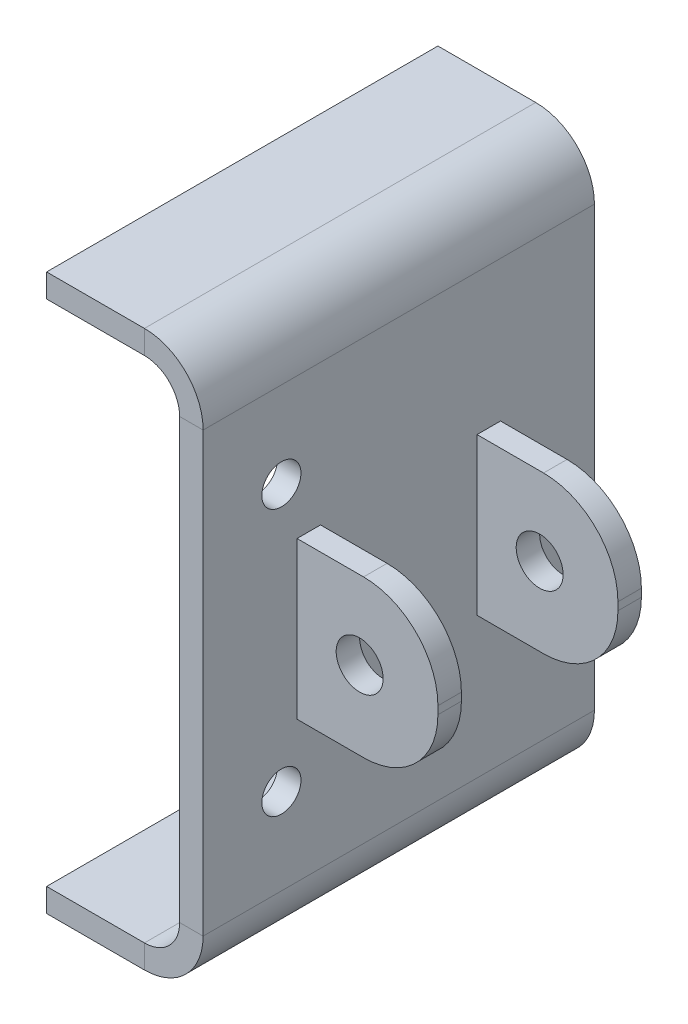
from build123d import *

# Parameters (mm, degrees)
SKETCH1_W                      = 65
SKETCH1_H                      = 50
BASE_FLANGE1_DEPTH             = 3
EDGE_FLANGE1_STRIP_W           = 21
EDGE_FLANGE1_STRIP_H           = 3
EDGE_FLANGE1_STRIP_CUT_DEPTH   = 50
EDGE_FLANGE1_STRIP_2_W         = 21
EDGE_FLANGE1_STRIP_2_H         = 3
EDGE_FLANGE1_STRIP_CUT_2_DEPTH = 50
EDGE_FLANGE1_DEPTH             = 50
EDGE_FLANGE1_BEND_DEPTH        = 50
SKETCH13_R                     = 2.5
CUT_EXTRUDE1_DEPTH             = 10
SKETCH14_W                     = 20
SKETCH14_H                     = 3
BOSS_EXTRUDE1_DEPTH            = 18
FILLET1_R                      = 9.5
SKETCH15_R                     = 3
CUT_EXTRUDE2_DEPTH             = 31


# Sheet-metal steps are written as plain solids
with BuildPart() as part:
    # Sketch1 → Base-Flange1 (new body)
    with BuildSketch(Plane.YZ):
        Rectangle(SKETCH1_W, SKETCH1_H)
    extrude(amount=BASE_FLANGE1_DEPTH)

    # Edge-Flange1 strip (across the edge) → Edge-Flange1 strip cut (cut)
    with BuildSketch(Plane(origin=(0, 32.5, 25), x_dir=(0, -1, 0), z_dir=(0, 0, -1))):
        with Locations((-6, -1.5)):
            Rectangle(EDGE_FLANGE1_STRIP_W, EDGE_FLANGE1_STRIP_H)
    extrude(amount=EDGE_FLANGE1_STRIP_CUT_DEPTH, mode=Mode.SUBTRACT)

    # Edge-Flange1 strip 2 (across the edge) → Edge-Flange1 strip cut 2 (cut)
    with BuildSketch(Plane(origin=(0, -32.5, -25), x_dir=(0, 1, 0), z_dir=(0, 0, 1))):
        with Locations((-6, -1.5)):
            Rectangle(EDGE_FLANGE1_STRIP_2_W, EDGE_FLANGE1_STRIP_2_H)
    extrude(amount=EDGE_FLANGE1_STRIP_CUT_2_DEPTH, mode=Mode.SUBTRACT)

    # Edge-Flange1 section (across the edge) → Edge-Flange1 (add)
    with BuildSketch(Plane(origin=(0, 32.5, 25), x_dir=(0, -1, 0), z_dir=(0, 0, -1))):
        with BuildLine():
            Line((-3, 4.5), (-3, 17))
            Line((-3, 17), (0, 17))
            Line((0, 17), (0, 4.5))
            ThreePointArc((0, 4.5), (1.318019485, 1.318019485), (4.5, 0))
            Line((4.5, 0), (4.5, -3))
            ThreePointArc((4.5, -3), (-0.803300859, -0.803300859), (-3, 4.5))
        make_face()
    extrude(amount=EDGE_FLANGE1_DEPTH)

    # Edge-Flange1 section 2 (across the edge) → Edge-Flange1 bend (add)
    with BuildSketch(Plane(origin=(0, -32.5, -25), x_dir=(0, 1, 0), z_dir=(0, 0, 1))):
        with BuildLine():
            Line((-3, 4.5), (-3, 17))
            Line((-3, 17), (0, 17))
            Line((0, 17), (0, 4.5))
            ThreePointArc((0, 4.5), (1.318019485, 1.318019485), (4.5, 0))
            Line((4.5, 0), (4.5, -3))
            ThreePointArc((4.5, -3), (-0.803300859, -0.803300859), (-3, 4.5))
        make_face()
    extrude(amount=EDGE_FLANGE1_BEND_DEPTH)

    # Sketch13 → Cut-Extrude1 (cut)
    with BuildSketch(Plane.YZ.offset(3)):
        with Locations(Location((-17, 15, 0), (0, 0, 270))):
            Circle(SKETCH13_R)
        with Locations(Location((17, 15, 0), (0, 0, 270))):
            Circle(SKETCH13_R)
    extrude(amount=-CUT_EXTRUDE1_DEPTH, mode=Mode.SUBTRACT)

    # Sketch14 → Boss-Extrude1 (add)
    with BuildSketch(Plane.YZ.offset(3)):
        with Locations((0, 11.5)):
            Rectangle(SKETCH14_W, SKETCH14_H)
        with Locations((0, -11.5)):
            Rectangle(SKETCH14_W, SKETCH14_H)
    extrude(amount=BOSS_EXTRUDE1_DEPTH)

    # Fillet1
    fillet1_edges = [part.edges().sort_by_distance(p)[0] for p in [
        (21, -10, 11.5),
        (21, 10, 11.5),
        (21, -10, -11.5),
        (21, 10, -11.5),
    ]]
    fillet(fillet1_edges, radius=FILLET1_R)

    # Sketch15 → Cut-Extrude2 (cut)
    with BuildSketch(Plane.XY.offset(13)):
        with Locations((11, 0)):
            Circle(SKETCH15_R)
    extrude(amount=-CUT_EXTRUDE2_DEPTH, mode=Mode.SUBTRACT)


solid = part.part
